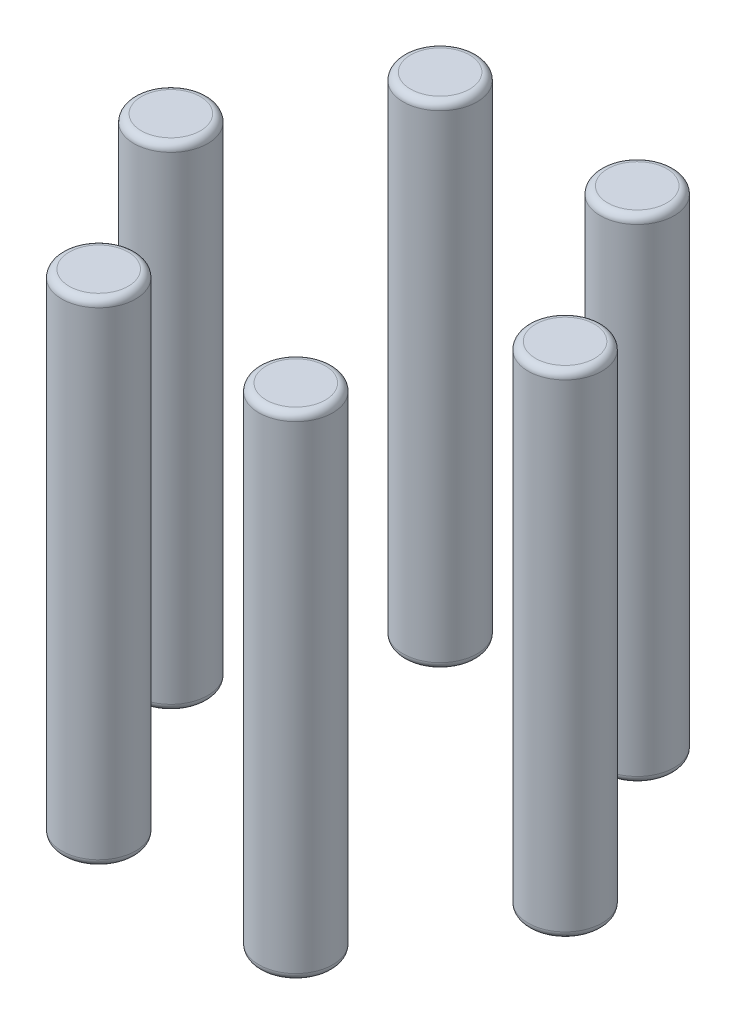
from build123d import *

# Parameters (mm, degrees)
BOSS_EXTRUDE1_DEPTH        = 14
BOSS_EXTRUDE1_DEPTH_BACK   = 6
SKETCH2_R                  = 1.5
BOSS_EXTRUDE1_2_DEPTH      = 14
BOSS_EXTRUDE1_2_DEPTH_BACK = 6
BOSS_EXTRUDE1_3_DEPTH      = 14
BOSS_EXTRUDE1_3_DEPTH_BACK = 6
BOSS_EXTRUDE1_4_DEPTH      = 14
BOSS_EXTRUDE1_4_DEPTH_BACK = 6
BOSS_EXTRUDE1_5_DEPTH      = 14
BOSS_EXTRUDE1_5_DEPTH_BACK = 6
BOSS_EXTRUDE1_6_DEPTH      = 14
BOSS_EXTRUDE1_6_DEPTH_BACK = 6
FILLET1_R                  = 0.3
FILLET2_R                  = 0.3
FILLET3_R                  = 0.3
FILLET4_R                  = 0.3
FILLET5_R                  = 0.3
FILLET6_R                  = 0.3
FILLET7_R                  = 0.3
FILLET8_R                  = 0.3
FILLET9_R                  = 0.3
FILLET10_R                 = 0.3
FILLET11_R                 = 0.3
FILLET12_R                 = 0.3


with BuildPart() as part:
    # Sketch2 → Boss-Extrude1 (new, two sides: drawn at the far end of the back side and taken through both)
    with BuildSketch(Plane(origin=(0, 0, 0), x_dir=(1, 0, 0), z_dir=(0, 1, 0)).offset(-BOSS_EXTRUDE1_DEPTH_BACK)):
        with Locations((7.5, 1.13e-07)):
            Circle(SKETCH2_R)
    extrude(amount=BOSS_EXTRUDE1_DEPTH + BOSS_EXTRUDE1_DEPTH_BACK)

    # Fillet4
    fillet4_edges = [part.edges().sort_by_distance(p)[0] for p in [
        (6, 14, -1.13e-07),
    ]]
    fillet(fillet4_edges, radius=FILLET4_R)

    # Fillet12
    fillet12_edges = [part.edges().sort_by_distance(p)[0] for p in [
        (6, -6, -1.13e-07),
    ]]
    fillet(fillet12_edges, radius=FILLET12_R)


with BuildPart() as body_2:
    # Sketch2 → Boss-Extrude1 2 (new, two sides: drawn at the far end of the back side and taken through both)
    with BuildSketch(Plane(origin=(0, 0, 0), x_dir=(1, 0, 0), z_dir=(0, 1, 0)).offset(-BOSS_EXTRUDE1_2_DEPTH_BACK)):
        with Locations((3.5, -6.928203117)):
            Circle(SKETCH2_R)
    extrude(amount=BOSS_EXTRUDE1_2_DEPTH + BOSS_EXTRUDE1_2_DEPTH_BACK)

    # Fillet5
    fillet5_edges = [body_2.edges().sort_by_distance(p)[0] for p in [
        (2, 14, 6.928203117),
    ]]
    fillet(fillet5_edges, radius=FILLET5_R)

    # Fillet8
    fillet8_edges = [body_2.edges().sort_by_distance(p)[0] for p in [
        (2, -6, 6.928203117),
    ]]
    fillet(fillet8_edges, radius=FILLET8_R)


with BuildPart() as body_3:
    # Sketch2 → Boss-Extrude1 3 (new, two sides: drawn at the far end of the back side and taken through both)
    with BuildSketch(Plane(origin=(0, 0, 0), x_dir=(1, 0, 0), z_dir=(0, 1, 0)).offset(-BOSS_EXTRUDE1_3_DEPTH_BACK)):
        with Locations((-4.5, -6.928203117)):
            Circle(SKETCH2_R)
    extrude(amount=BOSS_EXTRUDE1_3_DEPTH + BOSS_EXTRUDE1_3_DEPTH_BACK)

    # Fillet6
    fillet6_edges = [body_3.edges().sort_by_distance(p)[0] for p in [
        (-6, 14, 6.928203117),
    ]]
    fillet(fillet6_edges, radius=FILLET6_R)

    # Fillet7
    fillet7_edges = [body_3.edges().sort_by_distance(p)[0] for p in [
        (-6, -6, 6.928203117),
    ]]
    fillet(fillet7_edges, radius=FILLET7_R)


with BuildPart() as body_4:
    # Sketch2 → Boss-Extrude1 4 (new, two sides: drawn at the far end of the back side and taken through both)
    with BuildSketch(Plane(origin=(0, 0, 0), x_dir=(1, 0, 0), z_dir=(0, 1, 0)).offset(-BOSS_EXTRUDE1_4_DEPTH_BACK)):
        with Locations((-8.5, 1.13e-07)):
            Circle(SKETCH2_R)
    extrude(amount=BOSS_EXTRUDE1_4_DEPTH + BOSS_EXTRUDE1_4_DEPTH_BACK)

    # Fillet1
    fillet1_edges = [body_4.edges().sort_by_distance(p)[0] for p in [
        (-10, 14, -1.13e-07),
    ]]
    fillet(fillet1_edges, radius=FILLET1_R)

    # Fillet9
    fillet9_edges = [body_4.edges().sort_by_distance(p)[0] for p in [
        (-10, -6, -1.13e-07),
    ]]
    fillet(fillet9_edges, radius=FILLET9_R)


with BuildPart() as body_5:
    # Sketch2 → Boss-Extrude1 5 (new, two sides: drawn at the far end of the back side and taken through both)
    with BuildSketch(Plane(origin=(0, 0, 0), x_dir=(1, 0, 0), z_dir=(0, 1, 0)).offset(-BOSS_EXTRUDE1_5_DEPTH_BACK)):
        with Locations((-4.5, 6.928203343)):
            Circle(SKETCH2_R)
    extrude(amount=BOSS_EXTRUDE1_5_DEPTH + BOSS_EXTRUDE1_5_DEPTH_BACK)

    # Fillet2
    fillet2_edges = [body_5.edges().sort_by_distance(p)[0] for p in [
        (-6, 14, -6.928203343),
    ]]
    fillet(fillet2_edges, radius=FILLET2_R)

    # Fillet10
    fillet10_edges = [body_5.edges().sort_by_distance(p)[0] for p in [
        (-6, -6, -6.928203343),
    ]]
    fillet(fillet10_edges, radius=FILLET10_R)


with BuildPart() as body_6:
    # Sketch2 → Boss-Extrude1 6 (new, two sides: drawn at the far end of the back side and taken through both)
    with BuildSketch(Plane(origin=(0, 0, 0), x_dir=(1, 0, 0), z_dir=(0, 1, 0)).offset(-BOSS_EXTRUDE1_6_DEPTH_BACK)):
        with Locations((3.5, 6.928203343)):
            Circle(SKETCH2_R)
    extrude(amount=BOSS_EXTRUDE1_6_DEPTH + BOSS_EXTRUDE1_6_DEPTH_BACK)

    # Fillet3
    fillet3_edges = [body_6.edges().sort_by_distance(p)[0] for p in [
        (2, 14, -6.928203343),
    ]]
    fillet(fillet3_edges, radius=FILLET3_R)

    # Fillet11
    fillet11_edges = [body_6.edges().sort_by_distance(p)[0] for p in [
        (2, -6, -6.928203343),
    ]]
    fillet(fillet11_edges, radius=FILLET11_R)


solid = Compound([part.part, body_2.part, body_3.part, body_4.part, body_5.part, body_6.part])
